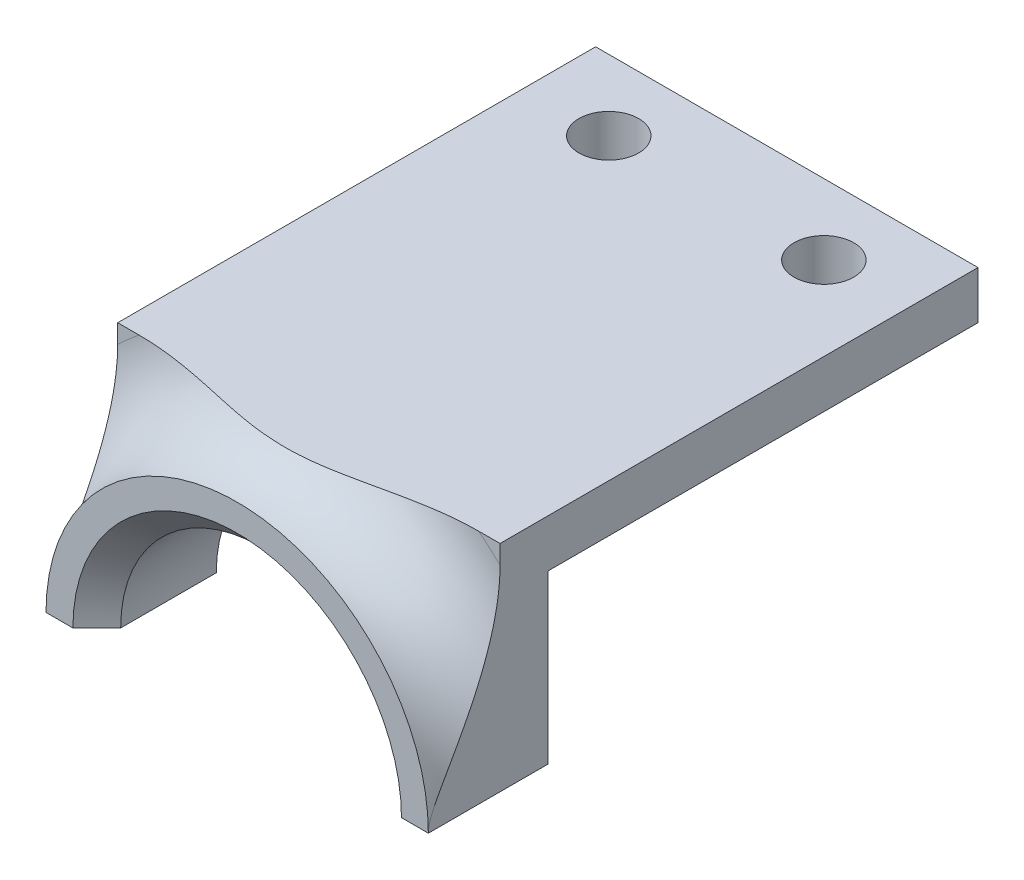
from build123d import *

# Parameters (mm, degrees)
BOSS_EXTRU_1_DEPTH      = 4
ESQUISSE2_W             = 32
ESQUISSE2_H             = 4
BOSS_EXTRU_2_DEPTH      = 36
BOSS_EXTRU_3_DEPTH      = 6
CONG_1_R                = 7
CHANFREIN1_SIZE         = 2
ESQUISSE4_R             = 2.5
ENL_V_MAT_EXTRU_1_DEPTH = 10


with BuildPart() as part:
    # Esquisse1 → Boss.-Extru.1 (new body)
    with BuildSketch(Plane.XY):
        with BuildLine():
            Line((-16, 18), (16, 18))
            Line((16, 18), (16, 0))
            Line((16, 0), (11.75, 0))
            ThreePointArc((11.75, 0), (0, 11.75), (-11.75, 0))
            Line((-11.75, 0), (-16, 0))
            Line((-16, 0), (-16, 18))
        make_face()
    extrude(amount=BOSS_EXTRU_1_DEPTH)

    # Esquisse2 → Boss.-Extru.2 (add)
    with BuildSketch(Plane(origin=(0, 0, 0), x_dir=(-1, 0, 0), z_dir=(0, 0, -1))):
        with Locations((0, 16)):
            Rectangle(ESQUISSE2_W, ESQUISSE2_H)
    extrude(amount=BOSS_EXTRU_2_DEPTH)

    # Esquisse3 → Boss.-Extru.3 (add)
    with BuildSketch(Plane.XY.offset(4)):
        with BuildLine():
            Line((-16, 0), (-11.75, 0))
            ThreePointArc((-11.75, 0), (0, 11.75), (11.75, 0))
            Line((11.75, 0), (16, 0))
            ThreePointArc((16, 0), (0, 16), (-16, 0))
        make_face()
    extrude(amount=BOSS_EXTRU_3_DEPTH)

    # Congé1
    # the kernel refuses this fillet: 7 mm, written as the material it adds along each edge
    with BuildSketch(Plane(origin=(0, 0, 4), x_dir=(1, 0, 0), z_dir=(0, -1, 0))) as cong_1_piece_1_section:
        with BuildLine():
            CenterArc((22.92820323, 7), CONG_1_R, 188.213210702, 81.786789298)
            Line((16, 6), (16, 0))
            Line((16, 0), (22.92820323, 0))
        make_face()
    cong_1_piece_1 = revolve(axis=Axis((0, 0, 4), (0, 0, 1)), revolution_arc=180, mode=Mode.PRIVATE)
    cong_1_piece_1 = split(cong_1_piece_1, bisect_by=Plane(origin=(0, 18, 4), z_dir=(0, -1, 0)), keep=Keep.TOP, mode=Mode.PRIVATE)
    cong_1_piece_1 = split(cong_1_piece_1, bisect_by=Plane(origin=(16, 0, 4), z_dir=(-1, 0, 0)), keep=Keep.TOP, mode=Mode.PRIVATE)
    cong_1_piece_1 = split(cong_1_piece_1, bisect_by=Plane(origin=(-16, 0, 4), z_dir=(1, 0, 0)), keep=Keep.TOP, mode=Mode.PRIVATE)
    add(cong_1_piece_1)

    # Chanfrein1
    chanfrein1_edges = [part.edges().sort_by_distance(p)[0] for p in [
        (0, 11.75, 10),
    ]]
    chamfer(chanfrein1_edges, length=CHANFREIN1_SIZE)

    # Esquisse4 → Enlèv. mat.-Extru.1 (cut)
    with BuildSketch(Plane(origin=(0, 18, 0), x_dir=(1, 0, 0), z_dir=(0, 1, 0))):
        with Locations(Location((9, 30.1, 0), (0, 0, 270))):
            Circle(ESQUISSE4_R)
        with Locations(Location((-9, 30.1, 0), (0, 0, 270))):
            Circle(ESQUISSE4_R)
    extrude(amount=-ENL_V_MAT_EXTRU_1_DEPTH, mode=Mode.SUBTRACT)


solid = part.part
